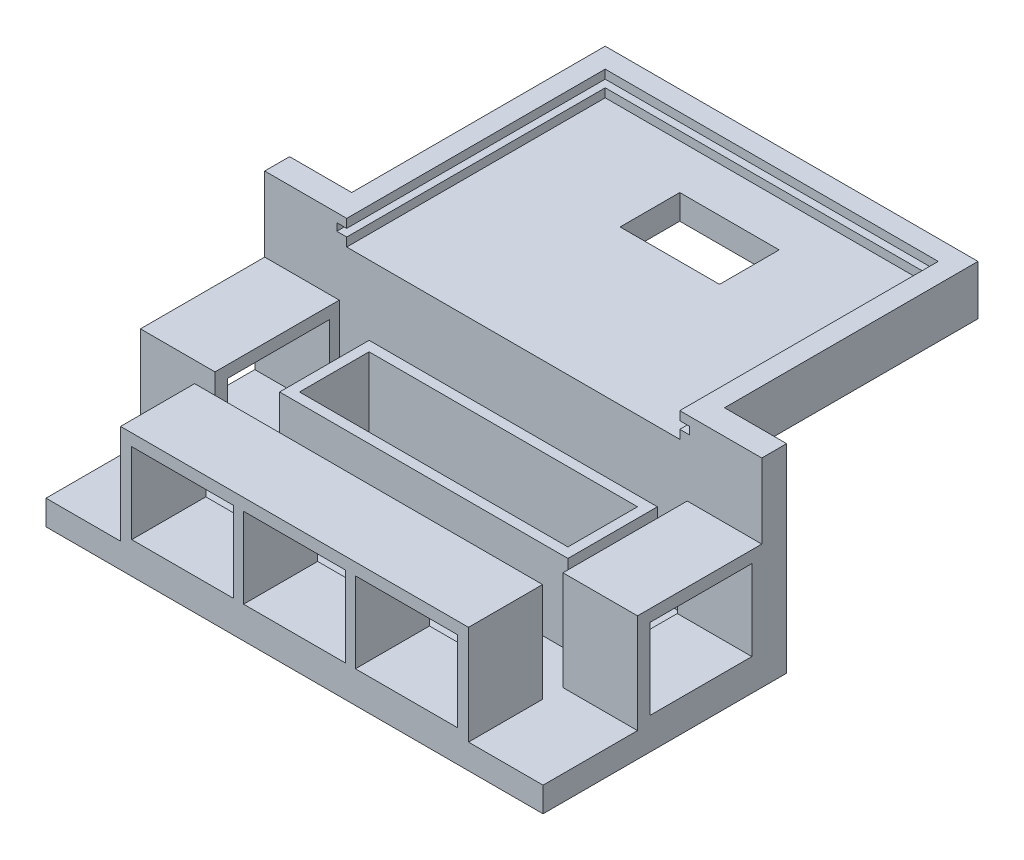
from build123d import *

# Parameters (mm, degrees)
CROQUIS1_W              = 100
CROQUIS1_H              = 49
SALIENTE_EXTRUIR1_DEPTH = 40
CROQUIS2_W              = 70
CROQUIS2_H              = 29
CORTAR_EXTRUIR1_DEPTH   = 35
CORTAR_EXTRUIR2_DEPTH   = 14.9
CORTAR_EXTRUIR4_DEPTH   = 119.325821358
CROQUIS6_W              = 20.5
CROQUIS6_H              = 16.2
CORTAR_EXTRUIR6_DEPTH   = 119.325821358
CROQUIS7_W              = 58
CROQUIS7_H              = 18
SALIENTE_EXTRUIR2_DEPTH = 16
CROQUIS8_W              = 54
CROQUIS8_H              = 14
CORTAR_EXTRUIR7_DEPTH   = 16
ENVOLVER2_START         = -2.5
ENVOLVER2_DEPTH         = 2.5
CROQUIS11_W             = 75
CROQUIS11_H             = 10
SALIENTE_EXTRUIR3_DEPTH = 51
CROQUIS12_W             = 67
CROQUIS12_H             = 52
CORTAR_EXTRUIR8_DEPTH   = 5
CROQUIS13_W             = 71
CROQUIS13_H             = 1.5
CORTAR_EXTRUIR9_DEPTH   = 54
CROQUIS14_W             = 20
CROQUIS14_H             = 12
CORTAR_EXTRUIR10_DEPTH  = 5
CORTAR_EXTRUIR11_REACH  = 148.969
CROQUIS5_W              = 20.5
CROQUIS5_H              = 16.2


# Read off the part's stored shape, not the designer's step: Envolver2
with BuildPart() as part:
    # Croquis1 → Saliente-Extruir1 (new body)
    with BuildSketch(Plane(origin=(0, 0, 0), x_dir=(1, 0, 0), z_dir=(0, 1, 0))):
        with Locations((50, 24.5)):
            Rectangle(CROQUIS1_W, CROQUIS1_H)
    extrude(amount=SALIENTE_EXTRUIR1_DEPTH)

    # Croquis2 → Cortar-Extruir1 (cut)
    with BuildSketch(Plane(origin=(0, 40, 0), x_dir=(1, 0, 0), z_dir=(0, 1, 0))):
        with Locations((50, 29.5)):
            Rectangle(CROQUIS2_W, CROQUIS2_H)
    extrude(amount=-CORTAR_EXTRUIR1_DEPTH, mode=Mode.SUBTRACT)

    # Croquis3 → Cortar-Extruir2 (cut)
    with BuildSketch(Plane.XY):
        Polygon((15, 5), (15, 25), (85, 25), (85, 5), (100, 5), (100, 40), (0, 40), (0, 5), align=None)
    extrude(amount=-CORTAR_EXTRUIR2_DEPTH, mode=Mode.SUBTRACT)

    # Croquis4 → Cortar-Extruir4 (cut, through all)
    with BuildSketch(Plane.ZY):
        Polygon((-44, 25), (-19, 25), (-19, 5), (-14.9, 5), (-14.9, 40), (-44, 40), align=None)
    extrude(amount=-CORTAR_EXTRUIR4_DEPTH, mode=Mode.SUBTRACT)

    # Croquis6 → Cortar-Extruir6 (cut, through all)
    with BuildSketch(Plane(origin=(100, 0, 0), x_dir=(0, 0, -1), z_dir=(1, 0, 0))):
        with Locations((31.75, 14.5)):
            Rectangle(CROQUIS6_W, CROQUIS6_H)
    extrude(amount=-CORTAR_EXTRUIR6_DEPTH, mode=Mode.SUBTRACT)

    # Croquis7 → Saliente-Extruir2 (add)
    with BuildSketch(Plane(origin=(0, 5, 0), x_dir=(1, 0, 0), z_dir=(0, 1, 0))):
        with Locations((50, 35)):
            Rectangle(CROQUIS7_W, CROQUIS7_H)
    extrude(amount=SALIENTE_EXTRUIR2_DEPTH)

    # Croquis8 → Cortar-Extruir7 (cut)
    with BuildSketch(Plane(origin=(0, 21, 0), x_dir=(1, 0, 0), z_dir=(0, 1, 0))):
        with Locations((50, 35)):
            Rectangle(CROQUIS8_W, CROQUIS8_H)
    extrude(amount=-CORTAR_EXTRUIR7_DEPTH, mode=Mode.SUBTRACT)

    # Envolver2 outline → Envolver2 (cut)
    # profile 1 of 3: a face of its own
    with BuildSketch(Plane(origin=(0, 5, 0), x_dir=(1, 0, 0), z_dir=(0, 1, 0)).offset(ENVOLVER2_START)):
        with BuildLine():
            add(Edge.make_bspline(
                [(44.845927513, 22.682039813), (44.880502524, 22.681581101), (44.94779002, 22.680688388), (45.045978034, 22.678103561), (45.138406194, 22.671034857), (45.225422346, 22.663758255), (45.306894242, 22.652117669), (45.382891805, 22.638865253), (45.453428219, 22.622573117), (45.519399834, 22.604194379), (45.582065701, 22.58175166), (45.642294727, 22.553081251), (45.700763218, 22.518735345), (45.757273689, 22.477750733), (45.813128977, 22.432374893), (45.865885411, 22.37921084), (45.918377238, 22.321807714), (45.967578278, 22.25830401), (46.01447324, 22.191680732), (46.054376208, 22.120908747), (46.088223994, 22.047966819), (46.117214563, 21.973058038), (46.136979973, 21.894799291), (46.154181469, 21.814812457), (46.162464556, 21.732060085), (46.163897144, 21.676148523), (46.164618555, 21.647993057)],
                knots=[0, 0, 0, 0, 0.054369818, 0.105810783, 0.1543913, 0.200099433, 0.243069893, 0.283740822, 0.321360744, 0.356845277, 0.391373506, 0.42587086, 0.461574928, 0.497826917, 0.535543491, 0.574581255, 0.615459073, 0.657779879, 0.700797841, 0.743450957, 0.785305491, 0.827181235, 0.869502041, 0.912065543, 0.955718718, 1, 1, 1, 1], degree=3))
            Line((44.845927513, 22.682039813), (43.424314244, 22.682039813))
            Line((43.424314244, 22.682039813), (42.805172718, 18.976839617))
            Line((42.805172718, 18.976839617), (43.469342719, 18.976839617))
            Line((43.469342719, 18.976839617), (43.718607489, 20.469211918))
            Line((43.718607489, 20.469211918), (44.603095383, 20.469211918))
            Line((44.603095383, 20.469211918), (45.04292709, 18.976839617))
            Line((45.04292709, 18.976839617), (45.752929645, 18.976839617))
            Line((45.752929645, 18.976839617), (45.28977962, 20.548011749))
            add(Edge.make_bspline(
                [(46.164618555, 21.647993057), (46.164091676, 21.617670303), (46.163039403, 21.5571103), (46.151744736, 21.467468845), (46.13622668, 21.379126232), (46.112503265, 21.292592771), (46.082048693, 21.207680933), (46.044780457, 21.124441143), (46.001130757, 21.043108672), (45.951712013, 20.9635574), (45.895224481, 20.887990565), (45.830214645, 20.819272615), (45.758276279, 20.757071565), (45.678885267, 20.701205138), (45.592072867, 20.652370985), (45.497799172, 20.610367641), (45.396617343, 20.574987864), (45.325850603, 20.557119534), (45.28977962, 20.548011749)],
                knots=[0, 0, 0, 0, 0.059520551, 0.118873267, 0.177208837, 0.235565778, 0.294841411, 0.354222133, 0.414510544, 0.476000381, 0.538010758, 0.599455515, 0.661405537, 0.724496825, 0.78978963, 0.856706752, 0.926961053, 1, 1, 1, 1], degree=3))
        make_face()
        with BuildLine():
            add(Edge.make_bspline(
                [(44.743809366, 21.03528417), (44.778129381, 21.03600119), (44.843652036, 21.0373701), (44.937526666, 21.044910102), (45.022020151, 21.059216882), (45.097465695, 21.079213334), (45.164300411, 21.104537257), (45.221481868, 21.136836672), (45.270624581, 21.17399479), (45.32077283, 21.232312946), (45.36864261, 21.310567266), (45.413007527, 21.407196099), (45.438530205, 21.507321555), (45.442292151, 21.574957755), (45.444162962, 21.608593141)],
                knots=[0, 0, 0, 0, 0.099664188, 0.190275618, 0.273183536, 0.348129931, 0.416633313, 0.480054439, 0.538277477, 0.594505454, 0.702244126, 0.80362549, 0.902343236, 1, 1, 1, 1], degree=3))
            Line((44.743809366, 21.03528417), (43.812684837, 21.03528417))
            Line((43.812684837, 21.03528417), (43.993602816, 22.115967561))
            Line((43.993602816, 22.115967561), (44.735768567, 22.115967561))
            add(Edge.make_bspline(
                [(45.444162962, 21.608593141), (45.443321191, 21.636863214), (45.441681994, 21.691914124), (45.421908744, 21.770970842), (45.392768442, 21.844328967), (45.35019923, 21.909220717), (45.300609579, 21.965653441), (45.246923641, 22.013950522), (45.187891151, 22.050903022), (45.122329195, 22.077622199), (45.046506806, 22.09459194), (44.957252302, 22.107151834), (44.85196106, 22.115045121), (44.776255138, 22.115646142), (44.735768567, 22.115967561)],
                knots=[0, 0, 0, 0, 0.084973229, 0.165470167, 0.24404472, 0.32176826, 0.397881214, 0.469968558, 0.538528016, 0.606605512, 0.682202732, 0.771959831, 0.878046995, 1, 1, 1, 1], degree=3))
        make_face(mode=Mode.SUBTRACT)
    # profile 2 of 3: a face of its own
    with BuildSketch(Plane(origin=(0, 5, 0), x_dir=(1, 0, 0), z_dir=(0, 1, 0)).offset(ENVOLVER2_START)):
        Polygon((46.976739258, 22.682039813), (46.357597732, 18.976839617), (48.79395984, 18.976839617), (48.892057588, 19.542911869), (47.113432841, 19.542911869), (47.285505941, 20.572134146), (48.696666171, 20.572134146), (48.78913536, 21.138206398), (47.379583289, 21.138206398), (47.54281151, 22.115967561), (49.257109864, 22.115967561), (49.355207612, 22.682039813), align=None)
    # profile 3 of 3: a face of its own
    with BuildSketch(Plane(origin=(0, 5, 0), x_dir=(1, 0, 0), z_dir=(0, 1, 0)).offset(ENVOLVER2_START)):
        Polygon((50.984273497, 22.682039813), (49.96148386, 22.682039813), (49.342342334, 18.976839617), (49.858561632, 18.976839617), (50.417397165, 22.321007936), (50.952914381, 18.976839617), (51.313946257, 18.976839617), (52.891551028, 22.350758892), (52.327086936, 18.976839617), (52.991256936, 18.976839617), (53.611202541, 22.682039813), (52.559466028, 22.682039813), (51.387921608, 20.172506434), align=None)
    extrude(amount=ENVOLVER2_DEPTH, mode=Mode.SUBTRACT)

    # Croquis11 → Saliente-Extruir3 (add)
    with BuildSketch(Plane(origin=(0, 0, -49), x_dir=(-1, 0, 0), z_dir=(0, 0, -1))):
        with Locations((-50, 35)):
            Rectangle(CROQUIS11_W, CROQUIS11_H)
    extrude(amount=SALIENTE_EXTRUIR3_DEPTH)

    # Croquis12 → Cortar-Extruir8 (cut)
    with BuildSketch(Plane(origin=(0, 40, 0), x_dir=(1, 0, 0), z_dir=(0, 1, 0))):
        with Locations((50, 70)):
            Rectangle(CROQUIS12_W, CROQUIS12_H)
    extrude(amount=-CORTAR_EXTRUIR8_DEPTH, mode=Mode.SUBTRACT)

    # Croquis13 → Cortar-Extruir9 (cut)
    with BuildSketch(Plane.XY.offset(-44)):
        with Locations((50, 37.5)):
            Rectangle(CROQUIS13_W, CROQUIS13_H)
    extrude(amount=-CORTAR_EXTRUIR9_DEPTH, mode=Mode.SUBTRACT)

    # Croquis14 → Cortar-Extruir10 (cut)
    with BuildSketch(Plane(origin=(0, 35, 0), x_dir=(1, 0, 0), z_dir=(0, 1, 0))):
        with Locations((50.5, 81)):
            Rectangle(CROQUIS14_W, CROQUIS14_H)
    extrude(amount=-CORTAR_EXTRUIR10_DEPTH, mode=Mode.SUBTRACT)

    # Croquis5 → Cortar-Extruir11 (cut, up to next)
    with BuildSketch(Plane.XY, mode=Mode.PRIVATE) as cortar_extruir11_sk1:
        with Locations((27.5, 14.5)):
            Rectangle(CROQUIS5_W, CROQUIS5_H)
    cortar_extruir11_tool1 = extrude(cortar_extruir11_sk1.sketch, amount=-CORTAR_EXTRUIR11_REACH, mode=Mode.PRIVATE) & part.part
    # Croquis5 → Cortar-Extruir11 (cut, up to next)
    with BuildSketch(Plane.XY, mode=Mode.PRIVATE) as cortar_extruir11_sk2:
        with Locations((50, 14.5)):
            Rectangle(CROQUIS5_W, CROQUIS5_H)
    cortar_extruir11_tool2 = extrude(cortar_extruir11_sk2.sketch, amount=-CORTAR_EXTRUIR11_REACH, mode=Mode.PRIVATE) & part.part
    # Croquis5 → Cortar-Extruir11 (cut, up to next)
    with BuildSketch(Plane.XY, mode=Mode.PRIVATE) as cortar_extruir11_sk3:
        with Locations((72.5, 14.5)):
            Rectangle(CROQUIS5_W, CROQUIS5_H)
    cortar_extruir11_tool3 = extrude(cortar_extruir11_sk3.sketch, amount=-CORTAR_EXTRUIR11_REACH, mode=Mode.PRIVATE) & part.part
    add(cortar_extruir11_tool1.solids().sort_by_distance((27.5, 14.5, 0))[0], mode=Mode.SUBTRACT)
    add(cortar_extruir11_tool2.solids().sort_by_distance((50, 14.5, 0))[0], mode=Mode.SUBTRACT)
    add(cortar_extruir11_tool3.solids().sort_by_distance((72.5, 14.5, 0))[0], mode=Mode.SUBTRACT)


solid = part.part
